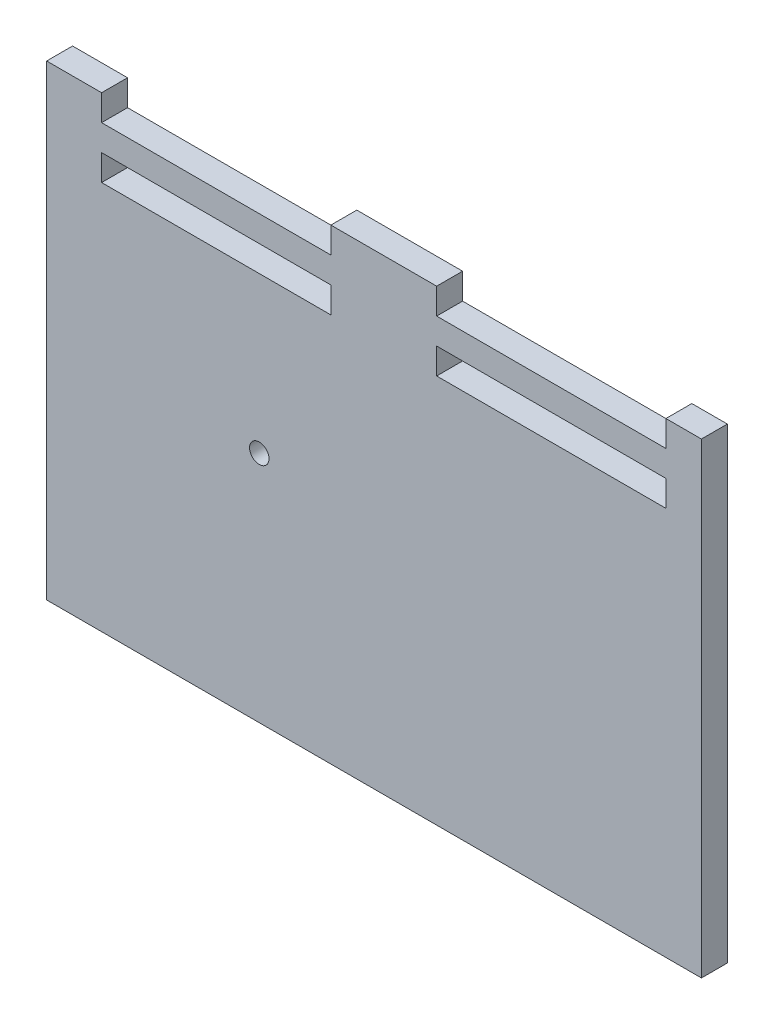
from build123d import *

# Parameters (mm, degrees)
SKETCH1_W           = 304.8
SKETCH1_H           = 228.6
BOSS_EXTRUDE1_DEPTH = 12.7
SKETCH2_R           = 4.7625
CUT_EXTRUDE1_DEPTH  = 12.7
SKETCH7_W           = 112.268
SKETCH7_H           = 12.7
CUT_EXTRUDE2_DEPTH  = 12.7
SKETCH8_W           = 3.175
SKETCH8_H           = 228.6
SKETCH8_W_2         = 12.7
BOSS_EXTRUDE2_DEPTH = 12.7


with BuildPart() as part:
    # Sketch1 → Boss-Extrude1 (new body)
    with BuildSketch(Plane.XY):
        with Locations((152.4, 114.3)):
            Rectangle(SKETCH1_W, SKETCH1_H)
    extrude(amount=BOSS_EXTRUDE1_DEPTH)

    # Sketch2 → Cut-Extrude1 (cut)
    with BuildSketch(Plane.XY.offset(12.7)):
        with Locations((91.44, 114.3)):
            Circle(SKETCH2_R)
    extrude(amount=-CUT_EXTRUDE1_DEPTH, mode=Mode.SUBTRACT)

    # Sketch7 → Cut-Extrude2 (cut)
    with BuildSketch(Plane.XY.offset(12.7)):
        with Locations((70.358, 222.25)):
            Rectangle(SKETCH7_W, SKETCH7_H)
        with Locations((234.442, 222.25)):
            Rectangle(SKETCH7_W, SKETCH7_H)
        with Locations((70.358, 196.85)):
            Rectangle(SKETCH7_W, SKETCH7_H)
        with Locations((234.442, 196.85)):
            Rectangle(SKETCH7_W, SKETCH7_H)
    extrude(amount=-CUT_EXTRUDE2_DEPTH, mode=Mode.SUBTRACT)

    # Sketch8 → Boss-Extrude2 (add)
    with BuildSketch(Plane.XY.offset(12.7)):
        with Locations((306.3875, 114.3)):
            Rectangle(SKETCH8_W, SKETCH8_H)
        with Locations((-6.35, 114.3)):
            Rectangle(SKETCH8_W_2, SKETCH8_H)
    extrude(amount=-BOSS_EXTRUDE2_DEPTH)


solid = part.part
